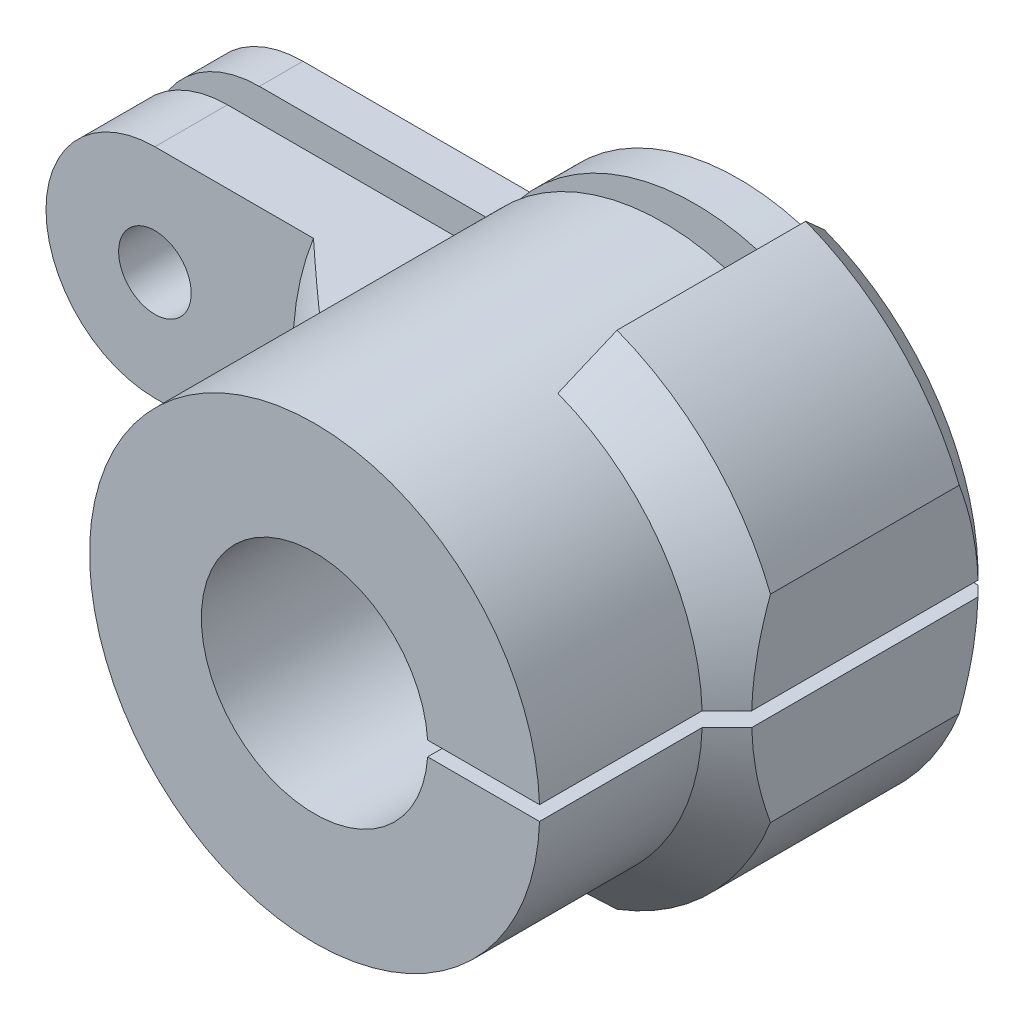
from build123d import *

# Parameters (mm, degrees)
SKETCH1_R                    = 15.5
SKETCH1_R_2                  = 7.8
BOSS_EXTRUDE1_DEPTH          = 24
SKETCH2_R                    = 2.5
SKETCH2_R_2                  = 7.8
BOSS_EXTRUDE2_DEPTH          = 5
SKETCH4_R                    = 2.5
SKETCH4_R_2                  = 7.8
BOSS_EXTRUDE3_DEPTH          = 3
BOSS_EXTRUDE4_DEPTH          = 15
CHAMFER1_SIZE                = 3
CHAMFER2_SIZE                = 2
CHAMFER3_SIZE                = 5
CUT_EXTRUDE_THIN1_DEPTH      = 51.568623258
CUT_EXTRUDE_THIN1_DEPTH_BACK = 50
SKETCH6_W                    = 28.833380518
SKETCH6_H                    = 1
SKETCH7_R                    = 32.954924651
CUT_EXTRUDE1_DEPTH           = 5


with BuildPart() as part:
    # Sketch1 → Boss-Extrude1 (new body)
    with BuildSketch(Plane.XY):
        Circle(SKETCH1_R)
        Circle(SKETCH1_R_2, mode=Mode.SUBTRACT)
    extrude(amount=BOSS_EXTRUDE1_DEPTH)

    # Sketch2 → Boss-Extrude2 (add)
    with BuildSketch(Plane(origin=(0, 0, 0), x_dir=(-1, 0, 0), z_dir=(0, 0, -1))):
        with BuildLine():
            Line((30, -7.5), (13.564659966, -7.5))
            ThreePointArc((13.564659966, -7.5), (-15.5, 0), (13.564659966, 7.5))
            Line((13.564659966, 7.5), (30, 7.5))
            ThreePointArc((30, 7.5), (37.5, 0), (30, -7.5))
        make_face()
        with Locations((30, 0)):
            Circle(SKETCH2_R, mode=Mode.SUBTRACT)
        with Locations(Location((0, 0, 0), (0, 0, 180))):
            Circle(SKETCH2_R_2, mode=Mode.SUBTRACT)
    extrude(amount=-BOSS_EXTRUDE2_DEPTH)



with BuildPart() as body_2:
    # Sketch4 → Boss-Extrude3 (new body)
    with BuildSketch(Plane(origin=(0, 0, -2.2), x_dir=(-1, 0, 0), z_dir=(0, 0, -1))):
        with BuildLine():
            Line((13.564659966, -7.5), (30, -7.5))
            ThreePointArc((30, -7.5), (37.5, 0), (30, 7.5))
            Line((30, 7.5), (13.564659966, 7.5))
            ThreePointArc((13.564659966, 7.5), (-15.5, 0), (13.564659966, -7.5))
        make_face()
        with Locations((30, 0)):
            Circle(SKETCH4_R, mode=Mode.SUBTRACT)
        with Locations(Location((0, 0, 0), (0, 0, 180))):
            Circle(SKETCH4_R_2, mode=Mode.SUBTRACT)
    extrude(amount=BOSS_EXTRUDE3_DEPTH)


with BuildPart() as part_1:
    add(part.part)

    add(body_2.part)  # Boss-Extrude4 merges body 2
    # Sketch5 → Boss-Extrude4 (add)
    with BuildSketch(Plane(origin=(0, 0, -5.2), x_dir=(-1, 0, 0), z_dir=(0, 0, -1))):
        with BuildLine():
            Line((-6.629807067, -17.27123789), (-5.554703218, -14.470496611))
            ThreePointArc((-5.554703218, -14.470496611), (-15.5, 0), (-5.554703218, 14.470496611))
            Line((-5.554703218, 14.470496611), (-6.629807067, 17.27123789))
            ThreePointArc((-6.629807067, 17.27123789), (-18.5, 0), (-6.629807067, -17.27123789))
        make_face()
    extrude(amount=-BOSS_EXTRUDE4_DEPTH)

    # Chamfer1
    chamfer1_edges = [part_1.edges().sort_by_distance(p)[0] for p in [
        (12.773955924, -8.779296672, 9.8),
    ]]
    chamfer(chamfer1_edges, length=CHAMFER1_SIZE - 0.0001)  # a hair under: the kernel refuses the full size

    # Chamfer2
    chamfer2_edges = [part_1.edges().sort_by_distance(p)[0] for p in [
        (18.5, 0, -5.2),
    ]]
    chamfer(chamfer2_edges, length=CHAMFER2_SIZE)

    # Chamfer3
    chamfer3_edges = [part_1.edges().sort_by_distance(p)[0] for p in [
        (-15.5, 0, 5),
    ]]
    chamfer(chamfer3_edges, length=CHAMFER3_SIZE)

    # Sketch6 → Cut-Extrude-Thin1 (cut, two sides: drawn at the far end of the back side and taken through both)
    with BuildSketch(Plane.XY.offset(24).offset(-CUT_EXTRUDE_THIN1_DEPTH_BACK)):
        with Locations((14.416690259, 0)):
            Rectangle(SKETCH6_W, SKETCH6_H)
    extrude(amount=CUT_EXTRUDE_THIN1_DEPTH + CUT_EXTRUDE_THIN1_DEPTH_BACK, mode=Mode.SUBTRACT)

    # Sketch7 → Cut-Extrude1 (cut)
    with BuildSketch(Plane(origin=(22.2, 0, 0), x_dir=(0, 0, -1), z_dir=(1, 0, 0))):
        with Locations((-8.942536343, 0)):
            Circle(SKETCH7_R)
    extrude(amount=-CUT_EXTRUDE1_DEPTH, mode=Mode.SUBTRACT)


solid = part_1.part
